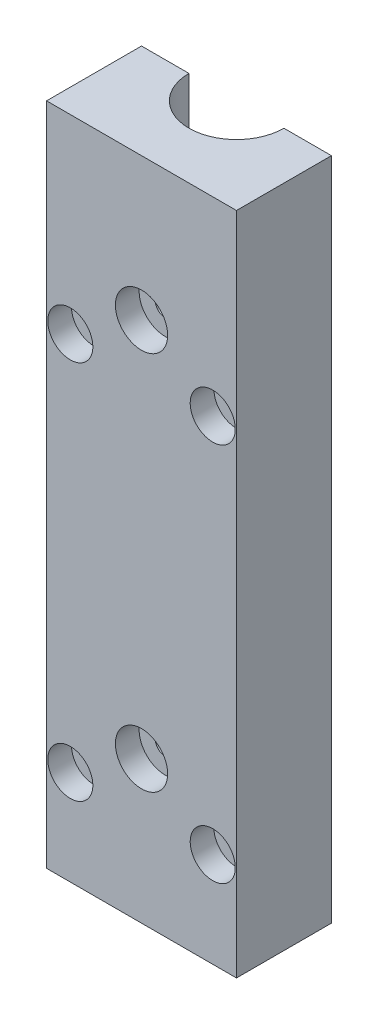
from build123d import *

# Parameters (mm, degrees)
SKETCH3_W           = 40
SKETCH3_H           = 140
BOSS_EXTRUDE1_DEPTH = 20
SKETCH4_R           = 10
CUT_EXTRUDE1_DEPTH  = 143.828568571
SKETCH6_R           = 5.5
SKETCH6_R_2         = 2.1
SKETCH6_R_3         = 4.75
CUT_EXTRUDE10_DEPTH = 5
SKETCH6_2_R         = 2.1
CUT_EXTRUDE11_DEPTH = 76.498344353


with BuildPart() as part:
    # Sketch3 → Boss-Extrude1 (new body)
    with BuildSketch(Plane.XY):
        Rectangle(SKETCH3_W, SKETCH3_H)
    extrude(amount=BOSS_EXTRUDE1_DEPTH)

    # Sketch4 → Cut-Extrude1 (cut, through all)
    with BuildSketch(Plane(origin=(0, 70, 0), x_dir=(1, 0, 0), z_dir=(0, 1, 0))):
        Circle(SKETCH4_R)
    extrude(amount=-CUT_EXTRUDE1_DEPTH, mode=Mode.SUBTRACT)

    # Sketch6 → Cut-Extrude10 (cut)
    # profile 1 of 6: a face of its own
    with BuildSketch(Plane.XY.offset(20)):
        with Locations((0, 40)):
            Circle(SKETCH6_R)
        with Locations((0, 40)):
            Circle(SKETCH6_R_2, mode=Mode.SUBTRACT)
    # profile 2 of 6: a face of its own
    with BuildSketch(Plane.XY.offset(20)):
        with Locations((0, -40)):
            Circle(SKETCH6_R)
        with Locations((0, -40)):
            Circle(SKETCH6_R_2, mode=Mode.SUBTRACT)
    # profile 3 of 6: a face of its own
    with BuildSketch(Plane.XY.offset(20)):
        with Locations((-15, 30)):
            Circle(SKETCH6_R_3)
        with Locations((-15, 30)):
            Circle(SKETCH6_R_2, mode=Mode.SUBTRACT)
    # profile 4 of 6: a face of its own
    with BuildSketch(Plane.XY.offset(20)):
        with Locations((-15, -50)):
            Circle(SKETCH6_R_3)
        with Locations((-15, -50)):
            Circle(SKETCH6_R_2, mode=Mode.SUBTRACT)
    # profile 5 of 6: a face of its own
    with BuildSketch(Plane.XY.offset(20)):
        with Locations((15, -50)):
            Circle(SKETCH6_R_3)
        with Locations((15, -50)):
            Circle(SKETCH6_R_2, mode=Mode.SUBTRACT)
    # profile 6 of 6: a face of its own
    with BuildSketch(Plane.XY.offset(20)):
        with Locations((15, 30)):
            Circle(SKETCH6_R_3)
        with Locations((15, 30)):
            Circle(SKETCH6_R_2, mode=Mode.SUBTRACT)
    extrude(amount=-CUT_EXTRUDE10_DEPTH, mode=Mode.SUBTRACT)

    # Sketch6<2> → Cut-Extrude11 (cut, through all)
    with BuildSketch(Plane.XY.offset(20)):
        with Locations((0, 40)):
            Circle(SKETCH6_2_R)
        with Locations((0, -40)):
            Circle(SKETCH6_2_R)
        with Locations((-15, 30)):
            Circle(SKETCH6_2_R)
        with Locations((-15, -50)):
            Circle(SKETCH6_2_R)
        with Locations((15, -50)):
            Circle(SKETCH6_2_R)
        with Locations((15, 30)):
            Circle(SKETCH6_2_R)
    extrude(amount=-CUT_EXTRUDE11_DEPTH, mode=Mode.SUBTRACT)


solid = part.part
